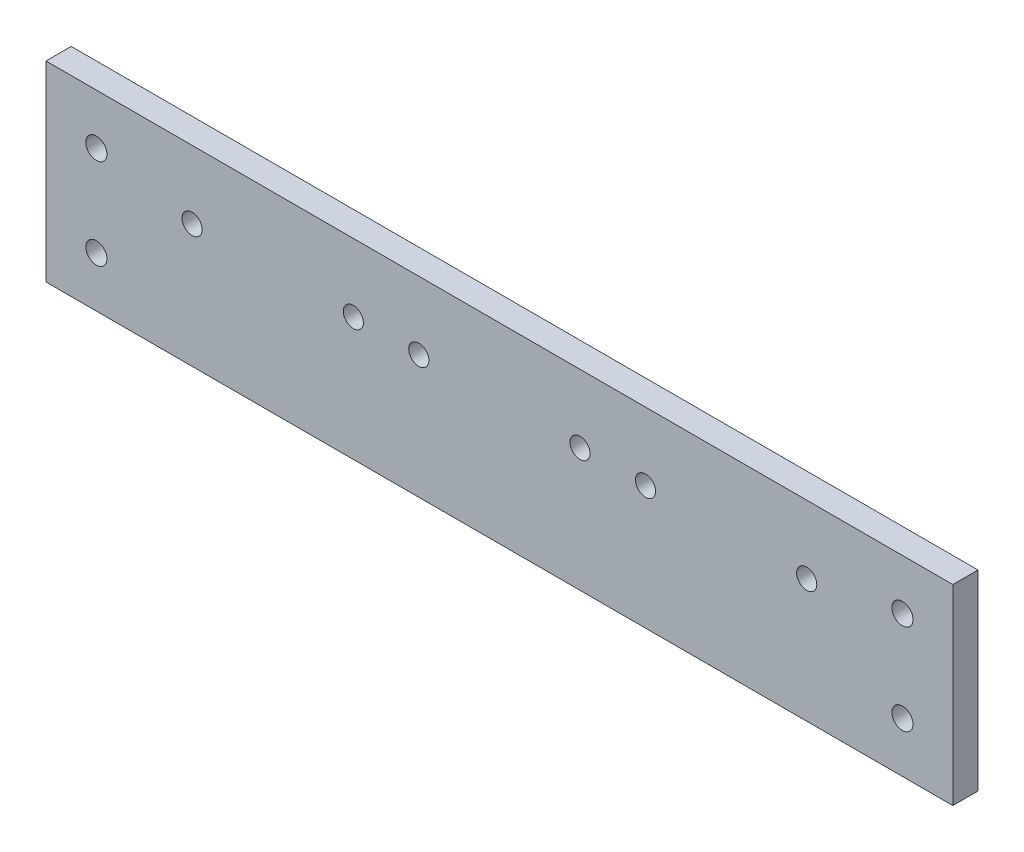
from build123d import *

# Parameters (mm, degrees)
SKETCH1_W           = 180
SKETCH1_H           = 38
SKETCH1_R           = 2.1
BOSS_EXTRUDE1_DEPTH = 5
SKETCH3_R           = 2
CUT_EXTRUDE2_DEPTH  = 22


with BuildPart() as part:
    # Sketch1 → Boss-Extrude1 (new body)
    with BuildSketch(Plane.XY):
        with Locations((90, -19)):
            Rectangle(SKETCH1_W, SKETCH1_H)
        with Locations((170, -10)):
            Circle(SKETCH1_R, mode=Mode.SUBTRACT)
        with Locations((170, -27.996930787)):
            Circle(SKETCH1_R, mode=Mode.SUBTRACT)
        with Locations((10, -10)):
            Circle(SKETCH1_R, mode=Mode.SUBTRACT)
        with Locations((10, -27.996930787)):
            Circle(SKETCH1_R, mode=Mode.SUBTRACT)
    extrude(amount=BOSS_EXTRUDE1_DEPTH)

    # Sketch3 → Cut-Extrude2 (cut)
    with BuildSketch(Plane.XY.offset(5)):
        with Locations((151, -13.5)):
            Circle(SKETCH3_R)
        with Locations((119, -13.5)):
            Circle(SKETCH3_R)
        with Locations((106, -13.5)):
            Circle(SKETCH3_R)
        with Locations((74, -13.5)):
            Circle(SKETCH3_R)
        with Locations((61, -13.5)):
            Circle(SKETCH3_R)
        with Locations((29, -13.5)):
            Circle(SKETCH3_R)
    extrude(amount=-CUT_EXTRUDE2_DEPTH, mode=Mode.SUBTRACT)


solid = part.part
